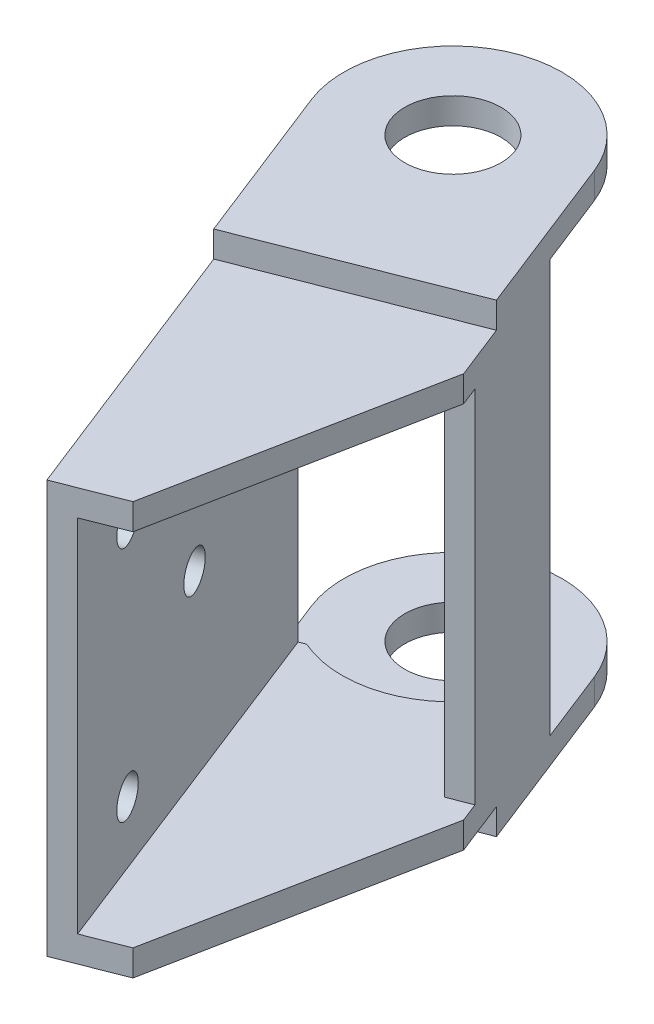
from build123d import *

# Parameters (mm, degrees)
SALIENTE_EXTRUIR1_START   = -2.75
SALIENTE_EXTRUIR1_DEPTH   = 5.5
SALIENTE_EXTRUIR1_2_DEPTH = 2.75
SALIENTE_EXTRUIR2_DEPTH   = 38
SALIENTE_EXTRUIR3_START   = 2.75
SALIENTE_EXTRUIR3_DEPTH   = 2.75
CROQUIS4_W                = 23
CROQUIS4_H                = 43.5
CORTAR_EXTRUIR1_DEPTH     = 8.25
CORTAR_EXTRUIR2_DEPTH     = 2.75
CROQUIS6_W                = 38
CROQUIS6_H                = 22.249999999
CORTAR_EXTRUIR3_DEPTH     = 16.59246817
CROQUIS7_W                = 3.203765914
CROQUIS7_H                = 38
CORTAR_EXTRUIR4_DEPTH     = 8.25
CROQUIS8_W                = 3.203765916
CROQUIS8_H                = 38
CORTAR_EXTRUIR5_DEPTH     = 8.25
CROQUIS9_W                = 14
CROQUIS9_H                = 38
CORTAR_EXTRUIR6_DEPTH     = 0.703765915
CROQUIS10_W               = 14
CROQUIS10_H               = 38
CORTAR_EXTRUIR7_DEPTH     = 0.703765915
SALIENTE_EXTRUIR4_START   = 2.75
SALIENTE_EXTRUIR4_DEPTH   = 2.75
CORTAR_EXTRUIR8_DEPTH     = 2.75
CROQUIS13_W               = 12.249999999
CROQUIS13_H               = 2.75
CORTAR_EXTRUIR9_DEPTH     = 74.034358614
CROQUIS14_W               = 12.249999999
CROQUIS14_H               = 2.75
CORTAR_EXTRUIR10_DEPTH    = 74.034358614
CROQUIS15_W               = 5
CROQUIS15_H               = 2.75
CROQUIS16_W               = 5
CROQUIS16_H               = 2.75
TALADRO1_D                = 10.15
TALADRO1_DEPTH            = 2.75
TALADRO2_D                = 10.15
CORTAR_EXTRUIR11_REACH    = 202.135
SALIENTE_EXTRUIR5_DEPTH   = 2.75
SALIENTE_EXTRUIR6_START   = -2.75
SALIENTE_EXTRUIR6_DEPTH   = 2.75
CROQUIS24_W               = 27.125
CROQUIS24_H               = 38
SALIENTE_EXTRUIR7_DEPTH   = 2.5
CROQUIS25_R               = 2
CORTAR_EXTRUIR12_DEPTH    = 2.5


with BuildPart() as part:
    # Saliente-Extruir1: read off the stored shape, not the designer's step
    # Saliente-Extruir1 outline → Saliente-Extruir1 (new body)
    with BuildSketch(Plane(origin=(0, 40.75, 0), x_dir=(-1, 0, 0), z_dir=(0, 1, 0)).offset(SALIENTE_EXTRUIR1_START)):
        with BuildLine():
            Line((161.177139208, 19.345694485), (182.584423689, 27.755698719))
            Line((182.584423689, 27.755698719), (171.432026769, 56.143619441))
            ThreePointArc((171.432026769, 56.143619441), (156.523382412, 62.642259564), (150.024742289, 47.733615207))
            Line((150.024742289, 47.733615207), (161.177139208, 19.345694485))
        make_face()
    extrude(amount=SALIENTE_EXTRUIR1_DEPTH)

    # Saliente-Extruir1 2 outline → Saliente-Extruir1 2 (add)
    with BuildSketch(Plane(origin=(0, 40.75, 0), x_dir=(-1, 0, 0), z_dir=(0, 1, 0))):
        with BuildLine():
            ThreePointArc((161.177139208, 19.345694485), (176.085783565, 12.847054362), (182.584423687, 27.755698719))
            Line((182.584423687, 27.755698719), (161.177139208, 19.345694485))
        make_face()
    extrude(amount=SALIENTE_EXTRUIR1_2_DEPTH)

    # Croquis2 → Saliente-Extruir2 (add)
    with BuildSketch(Plane.XZ.offset(-38)):
        Polygon((-171.432026768, 56.143619442), (-150.024742288, 47.733615205), (-161.177139209, 19.345694483), (-182.584423689, 27.755698719), align=None)
    extrude(amount=SALIENTE_EXTRUIR2_DEPTH)

    # Croquis3 → Saliente-Extruir3 (add)
    with BuildSketch(Plane.XZ.offset(SALIENTE_EXTRUIR3_START)):
        with BuildLine():
            Line((-182.584423688, 27.755698719), (-171.432026768, 56.143619441))
            ThreePointArc((-171.432026768, 56.143619441), (-156.523382412, 62.642259564), (-150.024742289, 47.733615207))
            Line((-150.024742289, 47.733615207), (-161.177139208, 19.345694485))
            Line((-161.177139208, 19.345694485), (-182.584423688, 27.755698719))
        make_face()
    extrude(amount=-SALIENTE_EXTRUIR3_DEPTH)

    # Croquis4 → Cortar-Extruir1 (cut)
    with BuildSketch(Plane(origin=(-14.965700114, 0, -38.094511116), x_dir=(-0.9307514991056489, 0, 0.3656523580022251), z_dir=(-0.3656523580022251, 0, -0.9307514991056489))):
        with Locations((168.589662745, 19)):
            Rectangle(CROQUIS4_W, CROQUIS4_H)
    extrude(amount=-CORTAR_EXTRUIR1_DEPTH, mode=Mode.SUBTRACT)

    # Croquis5 → Cortar-Extruir2 (cut)
    with BuildSketch(Plane(origin=(0, 40.75, 0), x_dir=(1, 0, 0), z_dir=(0, 1, 0))):
        with BuildLine():
            Line((-161.142417183, -28.195858914), (-176.585881806, -34.262934025))
            ThreePointArc((-176.585881806, -34.262934025), (-167.602648859, -34.440489141), (-161.142417183, -28.195858914))
        make_face()
    extrude(amount=-CORTAR_EXTRUIR2_DEPTH, mode=Mode.SUBTRACT)

    # Croquis6 → Cortar-Extruir3 (cut)
    with BuildSketch(Plane(origin=(-149.193349022, 0, 58.611670162), x_dir=(0, 1, 0), z_dir=(0.9307514991056486, 0, -0.3656523580022258))):
        with Locations((19, -21.553766865)):
            Rectangle(CROQUIS6_W, CROQUIS6_H)
    extrude(amount=-CORTAR_EXTRUIR3_DEPTH, mode=Mode.SUBTRACT)

    # Croquis7 → Cortar-Extruir4 (cut)
    with BuildSketch(Plane(origin=(-3.8133032, 0, -9.706590403), x_dir=(0.9307514990825102, 0, -0.36565235806112356), z_dir=(0.36565235806112356, 0, 0.9307514990825102))):
        with Locations((-158.691545702, 19)):
            Rectangle(CROQUIS7_W, CROQUIS7_H)
    extrude(amount=-CORTAR_EXTRUIR4_DEPTH, mode=Mode.SUBTRACT)

    # Croquis8 → Cortar-Extruir5 (cut)
    with BuildSketch(Plane(origin=(-3.8133032, 0, -9.706590403), x_dir=(0.9307514990825102, 0, -0.36565235806112356), z_dir=(0.36565235806112356, 0, 0.9307514990825102))):
        with Locations((-178.487779787, 19)):
            Rectangle(CROQUIS8_W, CROQUIS8_H)
    extrude(amount=-CORTAR_EXTRUIR5_DEPTH, mode=Mode.SUBTRACT)

    # Croquis9 → Cortar-Extruir6 (cut)
    with BuildSketch(Plane(origin=(-164.636813645, 0, 64.678745273), x_dir=(-0.3656523580022247, 0, -0.930751499105649), z_dir=(0.930751499105649, 1.4355340193330324e-15, -0.3656523580022247))):
        with Locations((25.678766864, 19)):
            Rectangle(CROQUIS9_W, CROQUIS9_H)
    extrude(amount=-CORTAR_EXTRUIR6_DEPTH, mode=Mode.SUBTRACT)

    # Croquis10 → Cortar-Extruir7 (cut)
    with BuildSketch(Plane(origin=(-149.193349022, 0, 58.611670162), x_dir=(0.3656523580022248, 0, 0.930751499105649), z_dir=(-0.930751499105649, -1.4355340193330322e-15, 0.3656523580022248))):
        with Locations((-25.678766864, 19)):
            Rectangle(CROQUIS10_W, CROQUIS10_H)
    extrude(amount=-CORTAR_EXTRUIR7_DEPTH, mode=Mode.SUBTRACT)

    # Croquis11 → Saliente-Extruir4 (add)
    with BuildSketch(Plane.XZ.offset(2.75).offset(SALIENTE_EXTRUIR4_START)):
        with BuildLine():
            Line((-150.024742289, 47.733615207), (-161.177139208, 19.345694485))
            ThreePointArc((-161.177139208, 19.345694485), (-176.085783565, 12.847054362), (-182.584423687, 27.755698719))
            Line((-182.584423687, 27.755698719), (-171.432026769, 56.143619441))
            ThreePointArc((-171.432026769, 56.143619441), (-156.523382412, 62.642259564), (-150.024742289, 47.733615207))
        make_face()
    extrude(amount=-SALIENTE_EXTRUIR4_DEPTH)

    # Croquis12 → Cortar-Extruir8 (cut)
    with BuildSketch(Plane(origin=(0, 0, 0), x_dir=(-1, 0, 0), z_dir=(0, 1, 0))):
        with BuildLine():
            Line((161.142417183, 28.195858914), (176.585881806, 34.262934025))
            ThreePointArc((176.585881806, 34.262934025), (167.602648859, 34.440489141), (161.142417183, 28.195858914))
        make_face()
    extrude(amount=-CORTAR_EXTRUIR8_DEPTH, mode=Mode.SUBTRACT)

    # Croquis13 → Cortar-Extruir9 (cut, through all)
    with BuildSketch(Plane(origin=(-146.211439094, 0, 57.440205601), x_dir=(-0.36565235800222584, 0, -0.9307514991056486), z_dir=(0.9307514991056486, 0, -0.36565235800222584))):
        with Locations((16.553766864, -4.125)):
            Rectangle(CROQUIS13_W, CROQUIS13_H)
    extrude(amount=-CORTAR_EXTRUIR9_DEPTH, mode=Mode.SUBTRACT)

    # Croquis14 → Cortar-Extruir10 (cut, through all)
    with BuildSketch(Plane(origin=(-146.211439094, 0, 57.440205601), x_dir=(-0.36565235800222584, 0, -0.9307514991056486), z_dir=(0.9307514991056486, 0, -0.36565235800222584))):
        with Locations((16.553766864, 42.125)):
            Rectangle(CROQUIS14_W, CROQUIS14_H)
    extrude(amount=-CORTAR_EXTRUIR10_DEPTH, mode=Mode.SUBTRACT)

    # Croquis15 → Revolución1 (revolve)
    with BuildSketch(Plane(origin=(0, 0, 51.938617325), x_dir=(-1, 0, 0), z_dir=(0, 0, -1))):
        with Locations((158.228384529, -4.125)):
            Rectangle(CROQUIS15_W, CROQUIS15_H)
    revolve(axis=Axis((-160.728384529, -5.5, 51.938617325), (0, 1, 0)))

    # Croquis16 → Revolución2 (revolve)
    with BuildSketch(Plane(origin=(0, 0, 51.938617325), x_dir=(-1, 0, 0), z_dir=(0, 0, -1))):
        with Locations((158.228384529, 42.125)):
            Rectangle(CROQUIS16_W, CROQUIS16_H)
    revolve(axis=Axis((-160.728384529, 40.75, 51.938617325), (0, 1, 0)))

    # Taladro1
    with Locations(Plane(origin=(0, -5.5, 0), x_dir=(-1, 0, 0), z_dir=(0, -1, 0))):
        with Locations((171.880781448, -23.550696602)):
            Hole(TALADRO1_D / 2, depth=TALADRO1_DEPTH)

    # Taladro2 (through all)
    with Locations(Plane(origin=(0, 40.75, 0), x_dir=(-1, 0, 0), z_dir=(0, -1, 0))):
        with Locations((171.880781448, -23.550696602)):
            Hole(TALADRO2_D / 2)

    # Cortar-Extruir11: up to this face of the body (flat: up to its plane)
    cortar_extruir11_end = Plane(part.part.faces().sort_by_distance((-169.996704911, 43.5, 28.346528005))[0])
    # Croquis21 → Cortar-Extruir11 (cut, up to the picked face)
    with BuildSketch(Plane.XZ.offset(5.5), mode=Mode.PRIVATE) as cortar_extruir11_sk1:
        Polygon((-173.671647461, 50.44276651), (-152.264362982, 42.032762276), (-144.951315822, 60.647792258), (-166.358600301, 69.057796492), align=None)
    cortar_extruir11_tool1 = split(extrude(cortar_extruir11_sk1.sketch, amount=-CORTAR_EXTRUIR11_REACH, mode=Mode.PRIVATE), bisect_by=cortar_extruir11_end, keep=Keep.BOTH, mode=Mode.PRIVATE)
    add(cortar_extruir11_tool1.solids().sort_by(Axis((-159.311482, -5.5, 55.545279), (0, 1, 0)))[0], mode=Mode.SUBTRACT)

    # Croquis22 → Saliente-Extruir5 (add)
    with BuildSketch(Plane.XZ.offset(2.75)):
        Polygon((-152.264362982, 42.032762276), (-173.671647461, 50.44276651), (-164.530338511, 73.711553987), (-158.015078017, 71.151987481), align=None)
    extrude(amount=-SALIENTE_EXTRUIR5_DEPTH)

    # Croquis23 → Saliente-Extruir6 (add)
    with BuildSketch(Plane(origin=(0, 40.75, 0), x_dir=(1, 0, 0), z_dir=(0, 1, 0)).offset(SALIENTE_EXTRUIR6_START)):
        Polygon((-158.015078017, -71.151987481), (-152.264362982, -42.032762276), (-173.671647461, -50.44276651), (-164.530338511, -73.711553987), align=None)
    extrude(amount=SALIENTE_EXTRUIR6_DEPTH)

    # Croquis24 → Saliente-Extruir7 (add)
    with BuildSketch(Plane(origin=(-167.618723573, 0, 65.850209835), x_dir=(0.36565235800222584, 0, 0.9307514991056486), z_dir=(-0.9307514991056486, 0, 0.36565235800222584))):
        with Locations((-5.116266864, 19)):
            Rectangle(CROQUIS24_W, CROQUIS24_H)
    extrude(amount=-SALIENTE_EXTRUIR7_DEPTH)

    # Croquis25 → Cortar-Extruir12 (cut)
    with BuildSketch(Plane(origin=(-167.618723573, 0, 65.850209835), x_dir=(0.36565235800222584, 0, 0.9307514991056486), z_dir=(-0.9307514991056486, 0, 0.36565235800222584))):
        with Locations((-0.866266864, 6.5)):
            Circle(CROQUIS25_R)
        with Locations((-0.866266864, 31.5)):
            Circle(CROQUIS25_R)
        with Locations((-13.366266864, 19)):
            Circle(CROQUIS25_R)
    extrude(amount=-CORTAR_EXTRUIR12_DEPTH, mode=Mode.SUBTRACT)


solid = part.part
